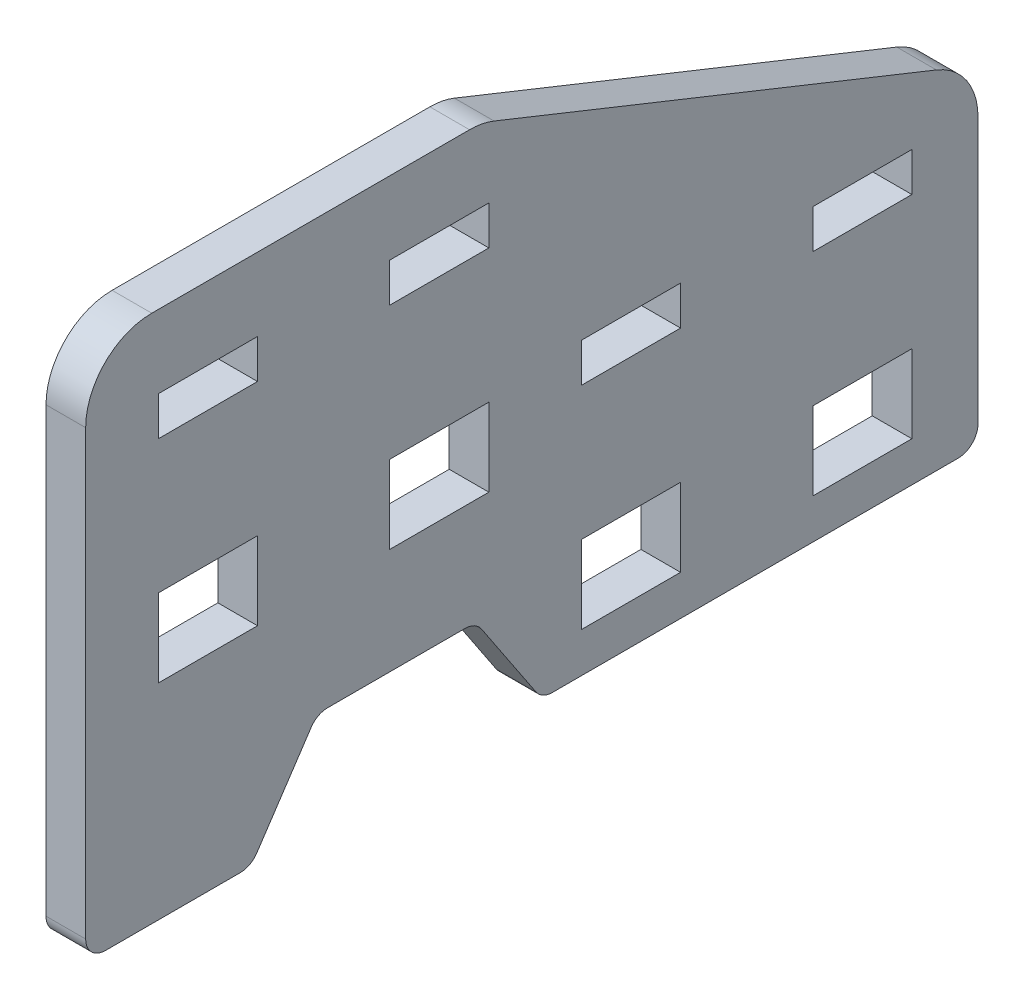
from build123d import *

# Parameters (mm, degrees)
GRUNDFORM_DEPTH          = 6
SKIZZE2_W                = 15
SKIZZE2_H                = 5.9
ZAPFENDURCHBRUCH_DEPTH   = 158.03821191
VERRUNDUNG1_R            = 10
VERRUNDUNG2_R            = 3
SKIZZE3_W                = 15
SKIZZE3_H                = 5.9
ZAPFENDURCHBRUCH_2_DEPTH = 158.03821191


with BuildPart() as part:
    # Skizze1 → Grundform (new body)
    with BuildSketch(Plane(origin=(0, 0, 0), x_dir=(0, 0, -1), z_dir=(1, 0, 0))):
        Polygon((0, 0), (25, 0), (35, 15), (59, 15), (69, 0), (135, 0), (135, 50), (60, 80), (0, 80), align=None)
    extrude(amount=GRUNDFORM_DEPTH)

    # Skizze2 → Zapfendurchbruch (cut, through all)
    with BuildSketch(Plane(origin=(6, 0, 0), x_dir=(0, 0, -1), z_dir=(1, 0, 0))):
        with Locations((82.5, 41)):
            Rectangle(SKIZZE2_W, SKIZZE2_H)
        with Locations((117.5, 41)):
            Rectangle(SKIZZE2_W, SKIZZE2_H)
        with Locations((117.5, 9)):
            Rectangle(SKIZZE2_W, SKIZZE2_H)
        with Locations((82.5, 9)):
            Rectangle(SKIZZE2_W, SKIZZE2_H)
        with Locations((53.5, 66)):
            Rectangle(SKIZZE2_W, SKIZZE2_H)
        with Locations((18.5, 66)):
            Rectangle(SKIZZE2_W, SKIZZE2_H)
        with Locations((18.5, 34)):
            Rectangle(SKIZZE2_W, SKIZZE2_H)
        with Locations((53.5, 34)):
            Rectangle(SKIZZE2_W, SKIZZE2_H)
    extrude(amount=-ZAPFENDURCHBRUCH_DEPTH, mode=Mode.SUBTRACT)

    # Verrundung1
    verrundung1_edges = [part.edges().sort_by_distance(p)[0] for p in [
        (3, 80, 0),
        (3, 80, -60),
        (3, 50, -135),
    ]]
    fillet(verrundung1_edges, radius=VERRUNDUNG1_R)

    # Verrundung2
    verrundung2_edges = [part.edges().sort_by_distance(p)[0] for p in [
        (3, 0, 0),
        (3, 0, -25),
        (3, 15, -35),
        (3, 15, -59),
        (3, 0, -69),
        (3, 0, -135),
    ]]
    fillet(verrundung2_edges, radius=VERRUNDUNG2_R)

    # Skizze3 → Zapfendurchbruch 2 (cut, through all)
    with BuildSketch(Plane.ZY):
        with Locations((-117.5, 14.9)):
            Rectangle(SKIZZE3_W, SKIZZE3_H)
        with Locations((-82.5, 14.9)):
            Rectangle(SKIZZE3_W, SKIZZE3_H)
        with Locations((-53.5, 39.9)):
            Rectangle(SKIZZE3_W, SKIZZE3_H)
        with Locations((-18.5, 39.9)):
            Rectangle(SKIZZE3_W, SKIZZE3_H)
    extrude(amount=-ZAPFENDURCHBRUCH_2_DEPTH, mode=Mode.SUBTRACT)


solid = part.part
